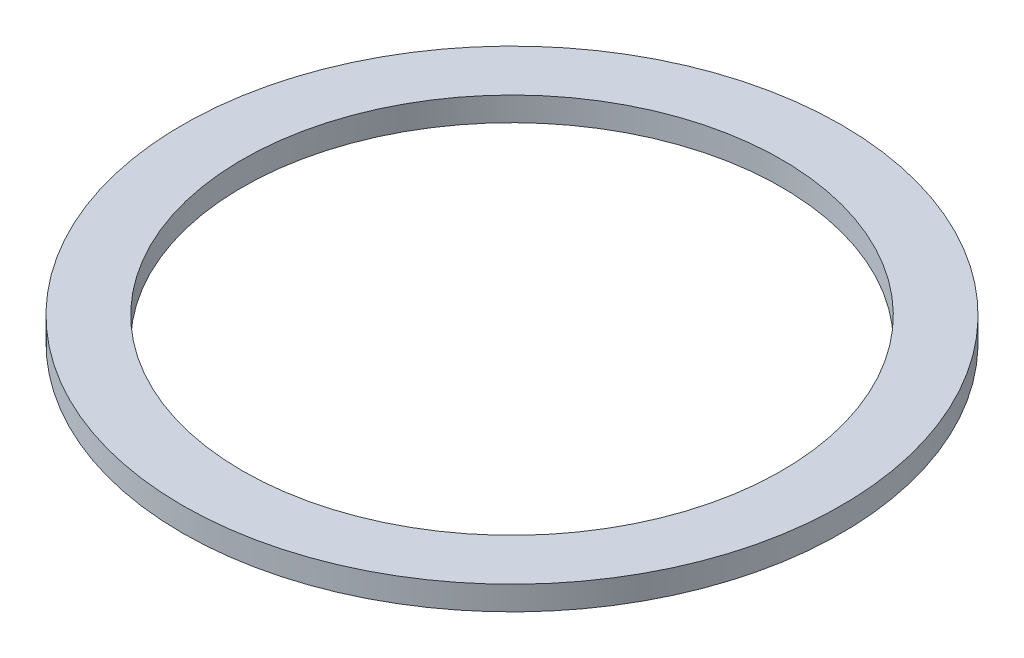
from build123d import *

# Parameters (mm, degrees)
SKETCH1_R           = 55
BOSS_EXTRUDE1_DEPTH = 4
SKETCH2_R           = 45
CUT_EXTRUDE1_DEPTH  = 78.884529914


with BuildPart() as part:
    # Sketch1 → Boss-Extrude1 (new body)
    with BuildSketch(Plane(origin=(0, 0, 0), x_dir=(1, 0, 0), z_dir=(0, 1, 0))):
        Circle(SKETCH1_R)
    extrude(amount=BOSS_EXTRUDE1_DEPTH)

    # Sketch2 → Cut-Extrude1 (cut, through all)
    with BuildSketch(Plane(origin=(0, 0, 0), x_dir=(1, 0, 0), z_dir=(0, 1, 0))):
        Circle(SKETCH2_R)
    extrude(amount=CUT_EXTRUDE1_DEPTH, mode=Mode.SUBTRACT)


solid = part.part
